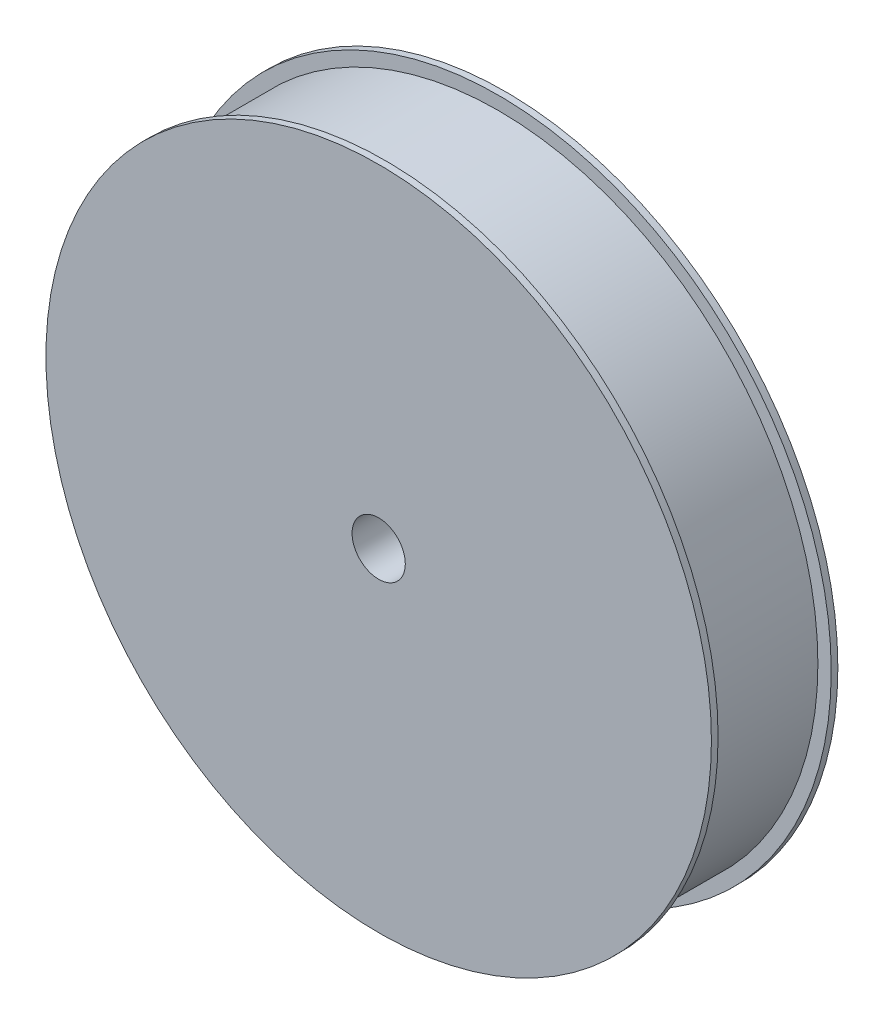
from build123d import *

# Parameters (mm, degrees)
INNER_R             = 76.2
BOSS_EXTRUDE1_DEPTH = 13.49375
RIM_R               = 79.375
BOSS_EXTRUDE2_DEPTH = 1.5875
HOLE_R              = 6.35
CUT_EXTRUDE1_DEPTH  = 117.234924426


with BuildPart() as part:
    # Inner → Boss-Extrude1 (new body)
    with BuildSketch(Plane.XY):
        Circle(INNER_R)
    extrude(amount=BOSS_EXTRUDE1_DEPTH)

    # Rim → Boss-Extrude2 (add)
    with BuildSketch(Plane.XY.offset(13.49375)):
        Circle(RIM_R)
    extrude(amount=BOSS_EXTRUDE2_DEPTH)

    # Mirror1: part across plane


with BuildPart() as part_1:
    add(part.part)
    add(part.part.mirror(Plane.XY))

    # Hole → Cut-Extrude1 (cut, through all)
    with BuildSketch(Plane.XY.offset(15.08125)):
        Circle(HOLE_R)
    extrude(amount=-CUT_EXTRUDE1_DEPTH, mode=Mode.SUBTRACT)


solid = part_1.part
